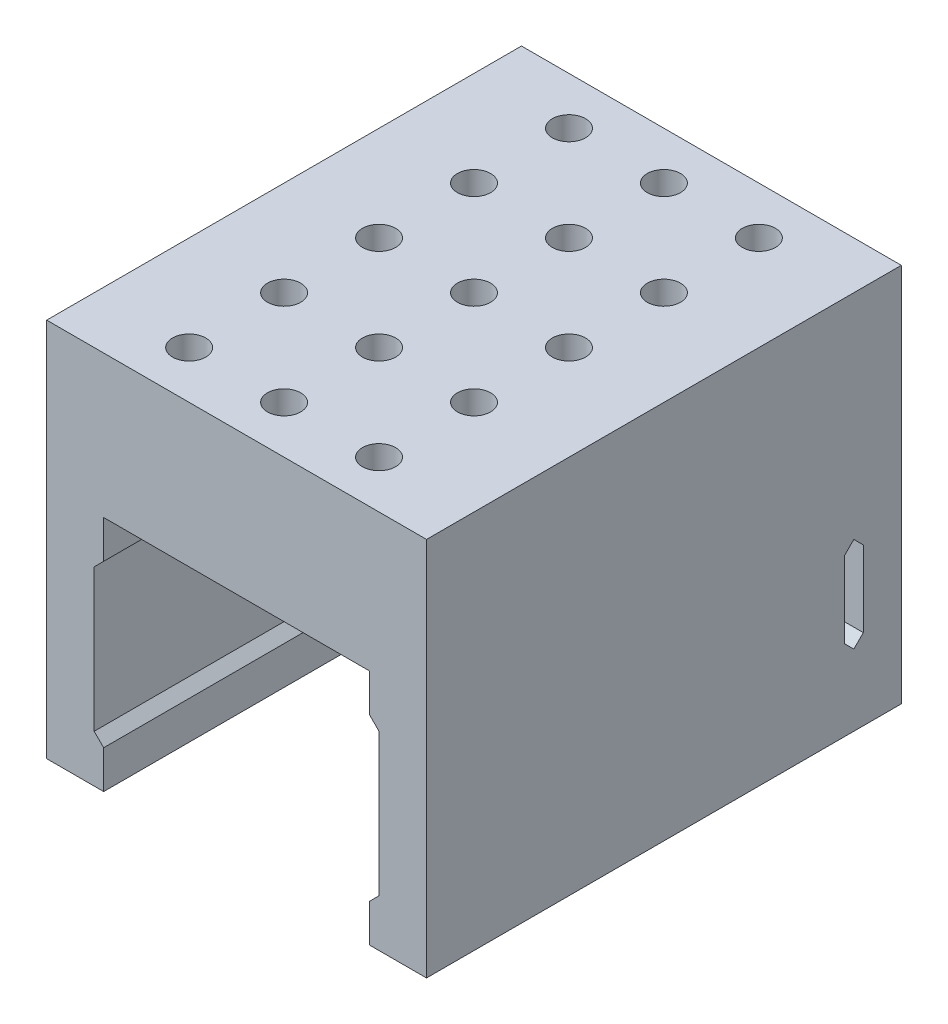
from build123d import *

# Parameters (mm, degrees)
SKETCH_1_W          = 40
SKETCH_1_H          = 40
SKETCH_1_W_2        = 30
SKETCH_1_H_2        = 15
EXTRUDE_1_DEPTH     = 50
CUT_EXTRUDE_START   = -50
SKETCH_3_W          = 28
SKETCH_3_H          = 25
CUT_EXTRUDE_1_DEPTH = 50
CHAMFER_1_SIZE      = 1
CUT_EXTRUDE_2_REACH = 77.498
SKETCH_4_R          = 1.75
SKETCH_5_W          = 2
SKETCH_5_H          = 10
CUT_EXTRUDE_4_DEPTH = 76.498344353
CHAMFER_3_SIZE      = 1


with BuildPart() as part:
    # ｽｹｯﾁ1 → ﾎﾞｽ - 押し出し1 (new body)
    with BuildSketch(Plane.XY):
        with Locations((20, 20)):
            Rectangle(SKETCH_1_W, SKETCH_1_H)
        with Locations((20, 12.5)):
            Rectangle(SKETCH_1_W_2, SKETCH_1_H_2, mode=Mode.SUBTRACT)
    extrude(amount=EXTRUDE_1_DEPTH)

    # ｽｹｯﾁ3 → ｶｯﾄ - 押し出し1 (cut)
    with BuildSketch(Plane(origin=(0, 0, 0), x_dir=(-1, 0, 0), z_dir=(0, 0, -1)).offset(CUT_EXTRUDE_START)):
        with Locations((-20, 12.5)):
            Rectangle(SKETCH_3_W, SKETCH_3_H)
    extrude(amount=CUT_EXTRUDE_1_DEPTH, mode=Mode.SUBTRACT)

    # 面取り1
    chamfer_1_edges = [part.edges().sort_by_distance(p)[0] for p in [
        (6, 20, 25),
        (6, 5, 25),
        (34, 5, 25),
        (34, 20, 25),
    ]]
    chamfer(chamfer_1_edges, length=CHAMFER_1_SIZE - 0.0001)  # a hair under: the kernel refuses the full size

    # ｽｹｯﾁ4 → ｶｯﾄ - 押し出し2 (cut, up to next)
    with BuildSketch(Plane(origin=(0, 40, 0), x_dir=(1, 0, 0), z_dir=(0, 1, 0)), mode=Mode.PRIVATE) as cut_extrude_2_sk1:
        with Locations(Location((10, -5, 0), (0, 0, 270))):
            Circle(SKETCH_4_R)
    cut_extrude_2_tool1 = extrude(cut_extrude_2_sk1.sketch, amount=-CUT_EXTRUDE_2_REACH, mode=Mode.PRIVATE) & part.part
    # ｽｹｯﾁ4 → ｶｯﾄ - 押し出し2 (cut, up to next)
    with BuildSketch(Plane(origin=(0, 40, 0), x_dir=(1, 0, 0), z_dir=(0, 1, 0)), mode=Mode.PRIVATE) as cut_extrude_2_sk2:
        with Locations(Location((20, -5, 0), (0, 0, 270))):
            Circle(SKETCH_4_R)
    cut_extrude_2_tool2 = extrude(cut_extrude_2_sk2.sketch, amount=-CUT_EXTRUDE_2_REACH, mode=Mode.PRIVATE) & part.part
    # ｽｹｯﾁ4 → ｶｯﾄ - 押し出し2 (cut, up to next)
    with BuildSketch(Plane(origin=(0, 40, 0), x_dir=(1, 0, 0), z_dir=(0, 1, 0)), mode=Mode.PRIVATE) as cut_extrude_2_sk3:
        with Locations(Location((30, -5, 0), (0, 0, 270))):
            Circle(SKETCH_4_R)
    cut_extrude_2_tool3 = extrude(cut_extrude_2_sk3.sketch, amount=-CUT_EXTRUDE_2_REACH, mode=Mode.PRIVATE) & part.part
    # ｽｹｯﾁ4 → ｶｯﾄ - 押し出し2 (cut, up to next)
    with BuildSketch(Plane(origin=(0, 40, 0), x_dir=(1, 0, 0), z_dir=(0, 1, 0)), mode=Mode.PRIVATE) as cut_extrude_2_sk4:
        with Locations(Location((10, -15, 0), (0, 0, 270))):
            Circle(SKETCH_4_R)
    cut_extrude_2_tool4 = extrude(cut_extrude_2_sk4.sketch, amount=-CUT_EXTRUDE_2_REACH, mode=Mode.PRIVATE) & part.part
    # ｽｹｯﾁ4 → ｶｯﾄ - 押し出し2 (cut, up to next)
    with BuildSketch(Plane(origin=(0, 40, 0), x_dir=(1, 0, 0), z_dir=(0, 1, 0)), mode=Mode.PRIVATE) as cut_extrude_2_sk5:
        with Locations(Location((20, -15, 0), (0, 0, 270))):
            Circle(SKETCH_4_R)
    cut_extrude_2_tool5 = extrude(cut_extrude_2_sk5.sketch, amount=-CUT_EXTRUDE_2_REACH, mode=Mode.PRIVATE) & part.part
    # ｽｹｯﾁ4 → ｶｯﾄ - 押し出し2 (cut, up to next)
    with BuildSketch(Plane(origin=(0, 40, 0), x_dir=(1, 0, 0), z_dir=(0, 1, 0)), mode=Mode.PRIVATE) as cut_extrude_2_sk6:
        with Locations(Location((30, -15, 0), (0, 0, 270))):
            Circle(SKETCH_4_R)
    cut_extrude_2_tool6 = extrude(cut_extrude_2_sk6.sketch, amount=-CUT_EXTRUDE_2_REACH, mode=Mode.PRIVATE) & part.part
    # ｽｹｯﾁ4 → ｶｯﾄ - 押し出し2 (cut, up to next)
    with BuildSketch(Plane(origin=(0, 40, 0), x_dir=(1, 0, 0), z_dir=(0, 1, 0)), mode=Mode.PRIVATE) as cut_extrude_2_sk7:
        with Locations(Location((10, -25, 0), (0, 0, 270))):
            Circle(SKETCH_4_R)
    cut_extrude_2_tool7 = extrude(cut_extrude_2_sk7.sketch, amount=-CUT_EXTRUDE_2_REACH, mode=Mode.PRIVATE) & part.part
    # ｽｹｯﾁ4 → ｶｯﾄ - 押し出し2 (cut, up to next)
    with BuildSketch(Plane(origin=(0, 40, 0), x_dir=(1, 0, 0), z_dir=(0, 1, 0)), mode=Mode.PRIVATE) as cut_extrude_2_sk8:
        with Locations(Location((20, -25, 0), (0, 0, 270))):
            Circle(SKETCH_4_R)
    cut_extrude_2_tool8 = extrude(cut_extrude_2_sk8.sketch, amount=-CUT_EXTRUDE_2_REACH, mode=Mode.PRIVATE) & part.part
    # ｽｹｯﾁ4 → ｶｯﾄ - 押し出し2 (cut, up to next)
    with BuildSketch(Plane(origin=(0, 40, 0), x_dir=(1, 0, 0), z_dir=(0, 1, 0)), mode=Mode.PRIVATE) as cut_extrude_2_sk9:
        with Locations(Location((30, -25, 0), (0, 0, 270))):
            Circle(SKETCH_4_R)
    cut_extrude_2_tool9 = extrude(cut_extrude_2_sk9.sketch, amount=-CUT_EXTRUDE_2_REACH, mode=Mode.PRIVATE) & part.part
    # ｽｹｯﾁ4 → ｶｯﾄ - 押し出し2 (cut, up to next)
    with BuildSketch(Plane(origin=(0, 40, 0), x_dir=(1, 0, 0), z_dir=(0, 1, 0)), mode=Mode.PRIVATE) as cut_extrude_2_sk10:
        with Locations(Location((10, -35, 0), (0, 0, 270))):
            Circle(SKETCH_4_R)
    cut_extrude_2_tool10 = extrude(cut_extrude_2_sk10.sketch, amount=-CUT_EXTRUDE_2_REACH, mode=Mode.PRIVATE) & part.part
    # ｽｹｯﾁ4 → ｶｯﾄ - 押し出し2 (cut, up to next)
    with BuildSketch(Plane(origin=(0, 40, 0), x_dir=(1, 0, 0), z_dir=(0, 1, 0)), mode=Mode.PRIVATE) as cut_extrude_2_sk11:
        with Locations(Location((20, -35, 0), (0, 0, 270))):
            Circle(SKETCH_4_R)
    cut_extrude_2_tool11 = extrude(cut_extrude_2_sk11.sketch, amount=-CUT_EXTRUDE_2_REACH, mode=Mode.PRIVATE) & part.part
    # ｽｹｯﾁ4 → ｶｯﾄ - 押し出し2 (cut, up to next)
    with BuildSketch(Plane(origin=(0, 40, 0), x_dir=(1, 0, 0), z_dir=(0, 1, 0)), mode=Mode.PRIVATE) as cut_extrude_2_sk12:
        with Locations(Location((30, -35, 0), (0, 0, 270))):
            Circle(SKETCH_4_R)
    cut_extrude_2_tool12 = extrude(cut_extrude_2_sk12.sketch, amount=-CUT_EXTRUDE_2_REACH, mode=Mode.PRIVATE) & part.part
    # ｽｹｯﾁ4 → ｶｯﾄ - 押し出し2 (cut, up to next)
    with BuildSketch(Plane(origin=(0, 40, 0), x_dir=(1, 0, 0), z_dir=(0, 1, 0)), mode=Mode.PRIVATE) as cut_extrude_2_sk13:
        with Locations(Location((10, -45, 0), (0, 0, 270))):
            Circle(SKETCH_4_R)
    cut_extrude_2_tool13 = extrude(cut_extrude_2_sk13.sketch, amount=-CUT_EXTRUDE_2_REACH, mode=Mode.PRIVATE) & part.part
    # ｽｹｯﾁ4 → ｶｯﾄ - 押し出し2 (cut, up to next)
    with BuildSketch(Plane(origin=(0, 40, 0), x_dir=(1, 0, 0), z_dir=(0, 1, 0)), mode=Mode.PRIVATE) as cut_extrude_2_sk14:
        with Locations(Location((20, -45, 0), (0, 0, 270))):
            Circle(SKETCH_4_R)
    cut_extrude_2_tool14 = extrude(cut_extrude_2_sk14.sketch, amount=-CUT_EXTRUDE_2_REACH, mode=Mode.PRIVATE) & part.part
    # ｽｹｯﾁ4 → ｶｯﾄ - 押し出し2 (cut, up to next)
    with BuildSketch(Plane(origin=(0, 40, 0), x_dir=(1, 0, 0), z_dir=(0, 1, 0)), mode=Mode.PRIVATE) as cut_extrude_2_sk15:
        with Locations(Location((30, -45, 0), (0, 0, 270))):
            Circle(SKETCH_4_R)
    cut_extrude_2_tool15 = extrude(cut_extrude_2_sk15.sketch, amount=-CUT_EXTRUDE_2_REACH, mode=Mode.PRIVATE) & part.part
    add(cut_extrude_2_tool1.solids().sort_by_distance((10, 40, 5))[0], mode=Mode.SUBTRACT)
    add(cut_extrude_2_tool2.solids().sort_by_distance((20, 40, 5))[0], mode=Mode.SUBTRACT)
    add(cut_extrude_2_tool3.solids().sort_by_distance((30, 40, 5))[0], mode=Mode.SUBTRACT)
    add(cut_extrude_2_tool4.solids().sort_by_distance((10, 40, 15))[0], mode=Mode.SUBTRACT)
    add(cut_extrude_2_tool5.solids().sort_by_distance((20, 40, 15))[0], mode=Mode.SUBTRACT)
    add(cut_extrude_2_tool6.solids().sort_by_distance((30, 40, 15))[0], mode=Mode.SUBTRACT)
    add(cut_extrude_2_tool7.solids().sort_by_distance((10, 40, 25))[0], mode=Mode.SUBTRACT)
    add(cut_extrude_2_tool8.solids().sort_by_distance((20, 40, 25))[0], mode=Mode.SUBTRACT)
    add(cut_extrude_2_tool9.solids().sort_by_distance((30, 40, 25))[0], mode=Mode.SUBTRACT)
    add(cut_extrude_2_tool10.solids().sort_by_distance((10, 40, 35))[0], mode=Mode.SUBTRACT)
    add(cut_extrude_2_tool11.solids().sort_by_distance((20, 40, 35))[0], mode=Mode.SUBTRACT)
    add(cut_extrude_2_tool12.solids().sort_by_distance((30, 40, 35))[0], mode=Mode.SUBTRACT)
    add(cut_extrude_2_tool13.solids().sort_by_distance((10, 40, 45))[0], mode=Mode.SUBTRACT)
    add(cut_extrude_2_tool14.solids().sort_by_distance((20, 40, 45))[0], mode=Mode.SUBTRACT)
    add(cut_extrude_2_tool15.solids().sort_by_distance((30, 40, 45))[0], mode=Mode.SUBTRACT)

    # ｽｹｯﾁ5 → ｶｯﾄ - 押し出し4 (cut, through all)
    with BuildSketch(Plane(origin=(40, 0, 0), x_dir=(0, 0, -1), z_dir=(1, 0, 0))):
        with Locations((-5, 12.5)):
            Rectangle(SKETCH_5_W, SKETCH_5_H)
    extrude(amount=-CUT_EXTRUDE_4_DEPTH, mode=Mode.SUBTRACT)

    # 面取り3
    chamfer_3_edges = [part.edges().sort_by_distance(p)[0] for p in [
        (2.5, 17.5, 6),
        (2.5, 17.5, 4),
        (2.5, 7.5, 4),
        (2.5, 7.5, 6),
        (37.5, 7.5, 4),
        (37.5, 7.5, 6),
        (37.5, 17.5, 4),
        (37.5, 17.5, 6),
    ]]
    chamfer(chamfer_3_edges, length=CHAMFER_3_SIZE - 0.0001)  # a hair under: the kernel refuses the full size


solid = part.part
